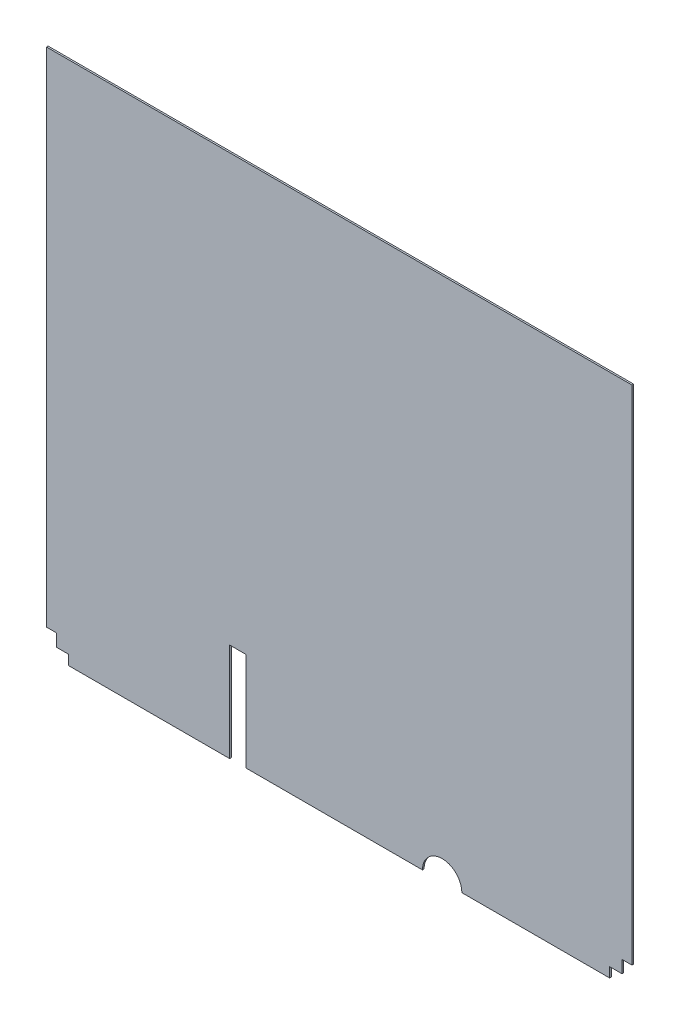
from build123d import *

# Parameters (mm, degrees)
BOSS_EXTRUDE1_DEPTH = 2.54


with BuildPart() as part:
    # Sketch1 → Boss-Extrude1 (new body)
    with BuildSketch(Plane.XY):
        with BuildLine():
            Line((0, 812.8), (0, 34.544))
            Line((0, 34.544), (15.24, 34.544))
            Line((15.24, 34.544), (15.24, 15.24))
            Line((15.24, 15.24), (34.544, 15.24))
            Line((34.544, 15.24), (34.544, 0))
            Line((34.544, 0), (283.837490085, 0))
            Line((283.837490085, 0), (283.837490085, 152.4))
            Line((283.837490085, 152.4), (309.237490085, 152.4))
            Line((309.237490085, 152.4), (309.237490085, 0))
            Line((309.237490085, 0), (582.538284777, 0))
            ThreePointArc((582.538284777, 0), (613.018284777, 30.48), (643.498284777, 0))
            Line((643.498284777, 0), (872.45698, 0))
            Line((872.45698, 0), (872.45698, 15.24))
            Line((872.45698, 15.24), (891.76098, 15.24))
            Line((891.76098, 15.24), (891.76098, 34.544))
            Line((891.76098, 34.544), (907.00098, 34.544))
            Line((907.00098, 34.544), (907.00098, 812.8))
            Line((907.00098, 812.8), (0, 812.8))
        make_face()
    extrude(amount=BOSS_EXTRUDE1_DEPTH)


solid = part.part
